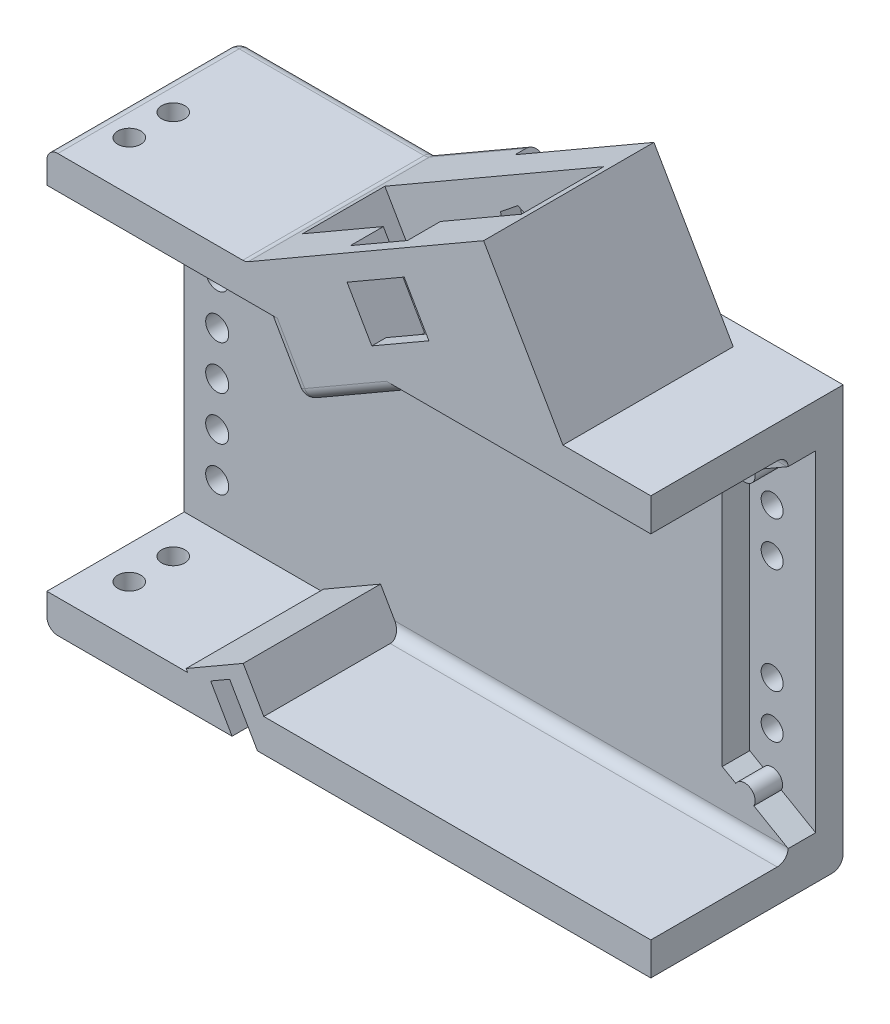
from build123d import *

# Parameters (mm, degrees)
SKETCH_2_W               = 109.92
SKETCH_2_H               = 76
EXTRUDE_1_DEPTH          = 10
CUT_EXTRUDE_1_DEPTH      = 5
SKETCH_4_R               = 2
CUT_EXTRUDE_2_DEPTH      = 92.808295873
SKETCH_5_W               = 109.92
SKETCH_5_H               = 6
EXTRUDE_2_DEPTH          = 25
CUT_EXTRUDE_3_DEPTH      = 104.340627651
CUT_EXTRUDE_3_DEPTH_BACK = 104.340627651
SKETCH_7_R               = 2.1
SKETCH_9_R               = 2.1
CUT_EXTRUDE_4_DEPTH      = 96.019804204
CUT_EXTRUDE_5_DEPTH      = 5
EXTRUDE_3_DEPTH          = 35
EXTRUDE_4_DEPTH          = 35
SKETCH_13_W              = 46
SKETCH_13_H              = 15
SKETCH_13_W_2            = 12
SKETCH_13_H_2            = 6
CUT_EXTRUDE_6_DEPTH      = 15
CUT_EXTRUDE_7_DEPTH      = 15
SKETCH_15_R              = 1.25
CUT_EXTRUDE_8_DEPTH      = 28.709519
EXTRUDE_5_DEPTH          = 35
CUT_EXTRUDE_10_DEPTH     = 4
CUT_EXTRUDE_11_REACH     = 116.42
SKETCH_22_R              = 2
CUT_EXTRUDE_12_DEPTH     = 3.5
CUT_EXTRUDE_14_REACH     = 117.568
EXTRUDE_6_DEPTH          = 3
FILLET_1_R               = 2


with BuildPart() as part:
    # 草圖2 → 填料-伸長1 (new body)
    with BuildSketch(Plane.XY):
        with Locations((12.52544527, 24.044160626)):
            Rectangle(SKETCH_2_W, SKETCH_2_H)
    extrude(amount=EXTRUDE_1_DEPTH)

    # 草圖3 → 除料-伸長1 (cut)
    with BuildSketch(Plane.XY.offset(10)):
        with BuildLine():
            Line((67.48544527, -6.055839374), (67.48544527, 54.144160626))
            Line((67.48544527, 54.144160626), (61.24181631, 50.538464901))
            ThreePointArc((61.24181631, 50.538464901), (61.408690367, 50.105080914), (61.46544527, 49.644160626))
            ThreePointArc((61.46544527, 49.644160626), (60.088104264, 47.81746208), (57.95299519, 48.639170705))
            Line((57.95299519, 48.639170705), (55.48544527, 47.214160626))
            Line((55.48544527, 47.214160626), (55.48544527, 0.874160626))
            Line((55.48544527, 0.874160626), (57.95299519, -0.550849453))
            ThreePointArc((57.95299519, -0.550849453), (60.088104264, 0.270859171), (61.46544527, -1.555839374))
            ThreePointArc((61.46544527, -1.555839374), (61.408690367, -2.016759663), (61.24181631, -2.45014365))
            Line((61.24181631, -2.45014365), (67.48544527, -6.055839374))
        make_face()
    extrude(amount=-CUT_EXTRUDE_1_DEPTH, mode=Mode.SUBTRACT)

    # 草圖4 → 除料-伸長2 (cut, through all)
    with BuildSketch(Plane.XY.offset(5)):
        with Locations((59.56544527, 41.644160626)):
            Circle(SKETCH_4_R)
        with Locations((59.56544527, 33.644160626)):
            Circle(SKETCH_4_R)
        with Locations((59.56544527, 6.444160626)):
            Circle(SKETCH_4_R)
        with Locations((59.56544527, 14.444160626)):
            Circle(SKETCH_4_R)
    extrude(amount=-CUT_EXTRUDE_2_DEPTH, mode=Mode.SUBTRACT)

    # 草圖5 → 填料-伸長2 (add)
    with BuildSketch(Plane.XY.offset(10)):
        with Locations((12.52544527, -10.955839374)):
            Rectangle(SKETCH_5_W, SKETCH_5_H)
        with Locations((12.52544527, 59.044160626)):
            Rectangle(SKETCH_5_W, SKETCH_5_H)
    extrude(amount=EXTRUDE_2_DEPTH)

    # 草圖7 → 除料-伸長3 (cut, two sides: drawn at the far end of the back side and taken through both)
    with BuildSketch(Plane(origin=(0, -7.955839374, 0), x_dir=(1, 0, 0), z_dir=(0, 1, 0)).offset(-CUT_EXTRUDE_3_DEPTH_BACK)):
        with Locations(Location((-36.43455473, -18, 0), (0, 0, 270))):
            Circle(SKETCH_7_R)
        with Locations(Location((-36.43455473, -26, 0), (0, 0, 270))):
            Circle(SKETCH_7_R)
    extrude(amount=CUT_EXTRUDE_3_DEPTH + CUT_EXTRUDE_3_DEPTH_BACK, mode=Mode.SUBTRACT)

    # 草圖9 → 除料-伸長4 (cut, through all)
    with BuildSketch(Plane.XY.offset(10)):
        with Locations((-36.43455473, 0.044160626)):
            Circle(SKETCH_9_R)
        with Locations((-36.43455473, 8.044160626)):
            Circle(SKETCH_9_R)
        with Locations((-36.43455473, 16.044160626)):
            Circle(SKETCH_9_R)
        with Locations((-36.43455473, 24.044160626)):
            Circle(SKETCH_9_R)
        with Locations((-36.43455473, 32.044160626)):
            Circle(SKETCH_9_R)
        with Locations((-36.43455473, 40.044160626)):
            Circle(SKETCH_9_R)
        with Locations((-36.43455473, 48.044160626)):
            Circle(SKETCH_9_R)
    extrude(amount=-CUT_EXTRUDE_4_DEPTH, mode=Mode.SUBTRACT)

    # 草圖10 → 除料-伸長5 (cut)
    with BuildSketch(Plane(origin=(0, 0, 0), x_dir=(-1, 0, 0), z_dir=(0, 0, -1))):
        with BuildLine():
            Line((32.43455473, 0.044160626), (32.43455473, 48.044160626))
            ThreePointArc((32.43455473, 48.044160626), (36.43455473, 52.044160626), (40.43455473, 48.044160626))
            Line((40.43455473, 48.044160626), (40.43455473, 0.044160626))
            ThreePointArc((40.43455473, 0.044160626), (36.43455473, -3.955839374), (32.43455473, 0.044160626))
        make_face()
    extrude(amount=-CUT_EXTRUDE_5_DEPTH, mode=Mode.SUBTRACT)

    # 草圖11 → 填料-伸長3 (add, through all)
    with BuildSketch(Plane.XY.offset(35)):
        Polygon((51.48544527, 62.044160626), (37.05168854, 87.044160626), (-6.249581649, 62.044160626), align=None)
    extrude(amount=-EXTRUDE_3_DEPTH)

    # 草圖12 → 填料-伸長4 (add)
    with BuildSketch(Plane.XY.offset(35)):
        Polygon((-6.249581649, 62.044160626), (37.05168854, 87.044160626), (47.05168854, 69.72365255), (3.750418351, 44.72365255), align=None)
    extrude(amount=-EXTRUDE_4_DEPTH)

    # 草圖13 → 除料-伸長6 (cut)
    with BuildSketch(Plane(origin=(-28.428305041, 49.239268705, 0), x_dir=(0.8660254037844416, 0.4999999999999949, 0), z_dir=(-0.4999999999999949, 0.8660254037844416, 0))):
        with Locations((50.609783842, -18.9)):
            Rectangle(SKETCH_13_W, SKETCH_13_H)
        with Locations((50.609783842, -29.4)):
            Rectangle(SKETCH_13_W_2, SKETCH_13_H_2)
    extrude(amount=-CUT_EXTRUDE_6_DEPTH, mode=Mode.SUBTRACT)

    # 草圖14 → 除料-伸長7 (cut)
    with BuildSketch(Plane(origin=(0, 0, 32.4), x_dir=(-1, 0, 0), z_dir=(0, 0, -1))):
        Polygon((-22.597205868, 74.080059011), (-27.097205868, 66.285830377), (-16.704901023, 60.285830377), (-12.204901023, 68.080059011), align=None)
    extrude(amount=-CUT_EXTRUDE_7_DEPTH, mode=Mode.SUBTRACT)

    # 草圖15 → 除料-伸長8 (cut)
    with BuildSketch(Plane(origin=(-20.928305041, 36.248887648, 0), x_dir=(0.8660254037844417, 0.4999999999999947, 0), z_dir=(-0.49999999999999484, 0.8660254037844418, 0))):
        with Locations(Location((69.109783842, -18.9, 0), (0, 0, 180))):
            Circle(SKETCH_15_R)
        with Locations(Location((32.109783842, -18.9, 0), (0, 0, 180))):
            Circle(SKETCH_15_R)
    extrude(amount=-CUT_EXTRUDE_8_DEPTH, mode=Mode.SUBTRACT)

    # 草圖18 → 填料-伸長5 (add)
    with BuildSketch(Plane.XY.offset(35)):
        Polygon((-13.593592417, -13.522826672), (-13.343592417, -13.955839374), (-8.724790263, -13.955839374), (-10.129490801, -11.522826672), align=None)
        Polygon((-17.093592417, -7.460648846), (-13.593592417, -13.522826672), (-10.129490801, -11.522826672), (-6.665389186, -9.522826672), (-3.201287571, -7.522826672), (-6.701287571, -1.460648846), align=None)
        Polygon((-3.201287571, -7.522826672), (-6.665389186, -9.522826672), (-4.10598811, -13.955839374), (0.512814044, -13.955839374), align=None)
    extrude(amount=-EXTRUDE_5_DEPTH)

    # 草圖21 → 除料-伸長10 (cut)
    with BuildSketch(Plane(origin=(0, 0, 0), x_dir=(-1, 0, 0), z_dir=(0, 0, -1))):
        Polygon((-37.05168854, 87.044160626), (-43.05168854, 76.65185578), (-51.48544527, 62.044160626), (-17.750418351, 62.044160626), (-11.750418351, 72.436465471), align=None)
    extrude(amount=-CUT_EXTRUDE_10_DEPTH, mode=Mode.SUBTRACT)

    # 草圖22 → 除料-伸長11 (cut, up to next)
    with BuildSketch(Plane(origin=(0, 0, 4), x_dir=(-1, 0, 0), z_dir=(0, 0, -1)), mode=Mode.PRIVATE) as cut_extrude_11_sk1:
        with Locations((-34.12348531, 76.115957396)):
            Circle(SKETCH_22_R)
    cut_extrude_11_tool1 = extrude(cut_extrude_11_sk1.sketch, amount=-CUT_EXTRUDE_11_REACH, mode=Mode.PRIVATE) & part.part
    # 草圖22 → 除料-伸長11 (cut, up to next)
    with BuildSketch(Plane(origin=(0, 0, 4), x_dir=(-1, 0, 0), z_dir=(0, 0, -1)), mode=Mode.PRIVATE) as cut_extrude_11_sk2:
        with Locations((-20.267078849, 68.115957396)):
            Circle(SKETCH_22_R)
    cut_extrude_11_tool2 = extrude(cut_extrude_11_sk2.sketch, amount=-CUT_EXTRUDE_11_REACH, mode=Mode.PRIVATE) & part.part
    add(cut_extrude_11_tool1.solids().sort_by_distance((34.123485, 76.115957, 4))[0], mode=Mode.SUBTRACT)
    add(cut_extrude_11_tool2.solids().sort_by_distance((20.267079, 68.115957, 4))[0], mode=Mode.SUBTRACT)

    # 草圖23 → 除料-伸長12 (cut)
    with BuildSketch(Plane.XY.offset(11.4)):
        Polygon((16.539589727, 69.567103439), (17.14660495, 65.613430145), (20.874094073, 64.162284101), (23.994567972, 66.664811352), (23.387552749, 70.618484646), (19.660063626, 72.06963069), align=None)
        Polygon((30.395996187, 77.567103439), (31.00301141, 73.613430145), (34.730500533, 72.162284101), (37.850974433, 74.664811352), (37.24395921, 78.618484646), (33.516470087, 80.06963069), align=None)
    extrude(amount=-CUT_EXTRUDE_12_DEPTH, mode=Mode.SUBTRACT)

    # 草圖24 → 除料-伸長14 (cut, up to next)
    with BuildSketch(Plane.XY.offset(35), mode=Mode.PRIVATE) as cut_extrude_14_sk1:
        Polygon((-7.570089725, -15.955839374), (-4.10598811, -13.955839374), (-9.165389186, -5.192699653), (-12.629490801, -7.192699653), align=None)
    cut_extrude_14_tool1 = extrude(cut_extrude_14_sk1.sketch, amount=-CUT_EXTRUDE_14_REACH, mode=Mode.PRIVATE) & part.part
    add(cut_extrude_14_tool1.solids().sort_by_distance((-8.367739, -10.57427, 35))[0], mode=Mode.SUBTRACT)

    # 草圖25 → 填料-伸長6 (add)
    with BuildSketch(Plane(origin=(0, 0, 0), x_dir=(-1, 0, 0), z_dir=(0, 0, -1))):
        Polygon((8.724790263, -13.955839374), (4.10598811, -13.955839374), (9.165389186, -5.192699653), (12.629490801, -7.192699653), align=None)
    extrude(amount=-EXTRUDE_6_DEPTH)

    # 圓角1
    fillet_1_edges = [part.edges().sort_by_distance(p)[0] for p in [
        (-24.34206819, 62.044160626, 0),
        (-6.249581649, 62.044160626, 17.5),
        (45.421779388, 56.044160626, 10),
        (0.482469159, 50.383906588, 10),
        (13.554265928, 50.383906588, 10),
        (3.750418351, 44.72365255, 22.5),
        (0.482469159, 50.383906588, 35),
        (13.554265928, 50.383906588, 35),
        (2.750418351, 67.240313048, 0),
        (12.52544527, -13.955839374, 0),
        (32.267078849, -7.955839374, 10),
        (-42.43455473, 24.044160626, 0),
        (-22.610017382, 56.044160626, 10),
        (-42.43455473, 62.044160626, 17.5),
        (-42.43455473, -13.955839374, 17.5),
    ]]
    fillet(fillet_1_edges, radius=FILLET_1_R - 0.0001)  # a hair under: the kernel refuses the full size


solid = part.part
